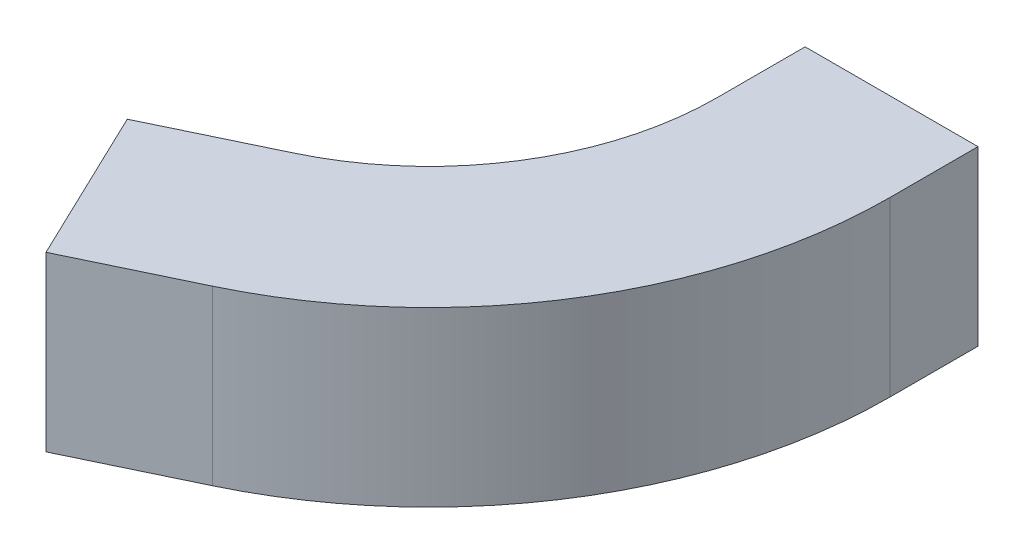
from build123d import *

# Parameters (mm, degrees)
BOSS_EXTRUDE1_DEPTH = 15


with BuildPart() as part:
    # Sketch1 → Boss-Extrude1 (new body)
    with BuildSketch(Plane(origin=(0, 0, 0), x_dir=(1, 0, 0), z_dir=(0, 1, 0))):
        with BuildLine():
            Line((25, 7.62), (25, 0))
            ThreePointArc((25, 0), (21.15250372, -13.325598913), (10.794273089, -22.549582446))
            Line((10.794273089, -22.549582446), (1.025793973, -27.225661548))
            Line((1.025793973, -27.225661548), (7.502357826, -40.755411016))
            Line((7.502357826, -40.755411016), (17.270836942, -36.079331914))
            ThreePointArc((17.270836942, -36.079331914), (33.844005951, -21.320958261), (40, 0))
            Line((40, 0), (40, 7.62))
            Line((40, 7.62), (25, 7.62))
        make_face()
    extrude(amount=BOSS_EXTRUDE1_DEPTH)


solid = part.part
